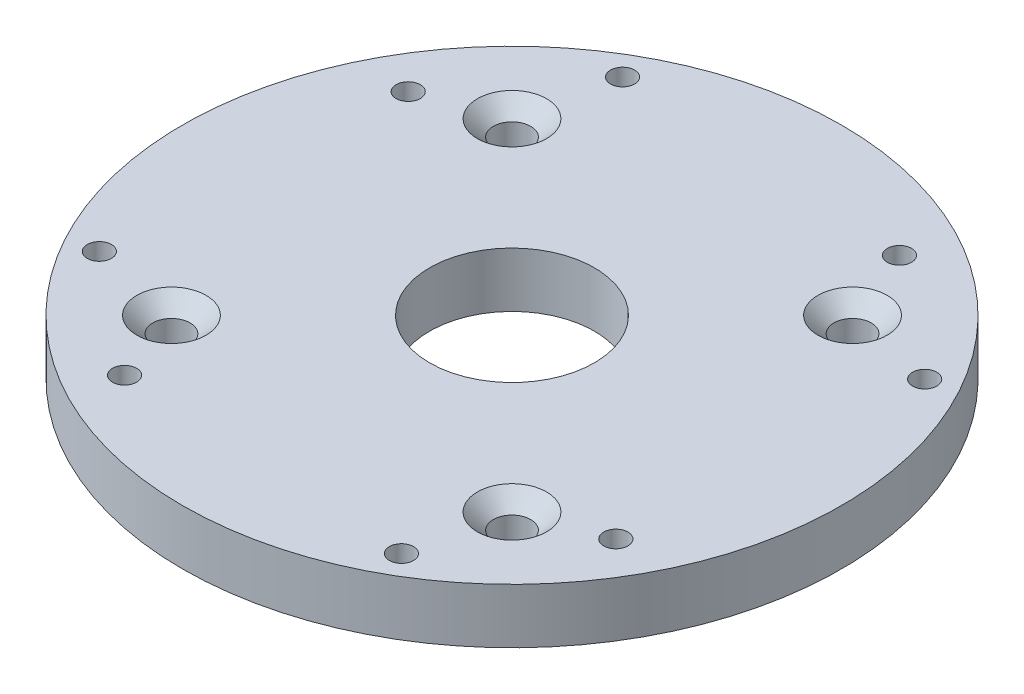
from build123d import *

# Parameters (mm, degrees)
SKETCH1_R                                       = 30
BOSS_EXTRUDE1_DEPTH                             = 5
CSK_FOR_M3_FLAT_HEAD_MACHINE_SCREW1_D           = 3.4
CSK_FOR_M3_FLAT_HEAD_MACHINE_SCREW1_CSINK_D     = 6.3
CSK_FOR_M3_FLAT_HEAD_MACHINE_SCREW1_CSINK_ANGLE = 90
CUT_EXTRUDE1_REACH                              = 44.72
SKETCH4_R                                       = 1.1
CUT_EXTRUDE2_REACH                              = 44.72
SKETCH5_R                                       = 7.5


with BuildPart() as part:
    # Sketch1 → Boss-Extrude1 (new body)
    with BuildSketch(Plane(origin=(0, 0, 0), x_dir=(1, 0, 0), z_dir=(0, 1, 0))):
        Circle(SKETCH1_R)
    extrude(amount=BOSS_EXTRUDE1_DEPTH)

    # CSK for M3 Flat Head Machine Screw1 (through all)
    with Locations(Plane(origin=(0, 5, 0), x_dir=(1, 0, 0), z_dir=(0, 1, 0))):
        with Locations((-15.5, -15.5), (15.5, 15.5), (-15.5, 15.5), (15.5, -15.5)):
            CounterSinkHole(CSK_FOR_M3_FLAT_HEAD_MACHINE_SCREW1_D / 2, CSK_FOR_M3_FLAT_HEAD_MACHINE_SCREW1_CSINK_D / 2, counter_sink_angle=CSK_FOR_M3_FLAT_HEAD_MACHINE_SCREW1_CSINK_ANGLE)

    # Sketch4 → Cut-Extrude1 (cut, up to next)
    with BuildSketch(Plane(origin=(0, 5, 0), x_dir=(1, 0, 0), z_dir=(0, 1, 0)), mode=Mode.PRIVATE) as cut_extrude1_sk1:
        with Locations((-13.75, 23.815698604)):
            Circle(SKETCH4_R)
    cut_extrude1_tool1 = extrude(cut_extrude1_sk1.sketch, amount=-CUT_EXTRUDE1_REACH, mode=Mode.PRIVATE) & part.part
    # Sketch4 → Cut-Extrude1 (cut, up to next)
    with BuildSketch(Plane(origin=(0, 5, 0), x_dir=(1, 0, 0), z_dir=(0, 1, 0)), mode=Mode.PRIVATE) as cut_extrude1_sk2:
        with Locations((-22.360001818, 12.909553069)):
            Circle(SKETCH4_R)
    cut_extrude1_tool2 = extrude(cut_extrude1_sk2.sketch, amount=-CUT_EXTRUDE1_REACH, mode=Mode.PRIVATE) & part.part
    # Sketch4 → Cut-Extrude1 (cut, up to next)
    with BuildSketch(Plane(origin=(0, 5, 0), x_dir=(1, 0, 0), z_dir=(0, 1, 0)), mode=Mode.PRIVATE) as cut_extrude1_sk3:
        with Locations((12.909553069, 22.360001818)):
            Circle(SKETCH4_R)
    cut_extrude1_tool3 = extrude(cut_extrude1_sk3.sketch, amount=-CUT_EXTRUDE1_REACH, mode=Mode.PRIVATE) & part.part
    # Sketch4 → Cut-Extrude1 (cut, up to next)
    with BuildSketch(Plane(origin=(0, 5, 0), x_dir=(1, 0, 0), z_dir=(0, 1, 0)), mode=Mode.PRIVATE) as cut_extrude1_sk4:
        with Locations((23.815698604, 13.75)):
            Circle(SKETCH4_R)
    cut_extrude1_tool4 = extrude(cut_extrude1_sk4.sketch, amount=-CUT_EXTRUDE1_REACH, mode=Mode.PRIVATE) & part.part
    # Sketch4 → Cut-Extrude1 (cut, up to next)
    with BuildSketch(Plane(origin=(0, 5, 0), x_dir=(1, 0, 0), z_dir=(0, 1, 0)), mode=Mode.PRIVATE) as cut_extrude1_sk5:
        with Locations((22.360001818, -12.909553069)):
            Circle(SKETCH4_R)
    cut_extrude1_tool5 = extrude(cut_extrude1_sk5.sketch, amount=-CUT_EXTRUDE1_REACH, mode=Mode.PRIVATE) & part.part
    # Sketch4 → Cut-Extrude1 (cut, up to next)
    with BuildSketch(Plane(origin=(0, 5, 0), x_dir=(1, 0, 0), z_dir=(0, 1, 0)), mode=Mode.PRIVATE) as cut_extrude1_sk6:
        with Locations((13.75, -23.815698604)):
            Circle(SKETCH4_R)
    cut_extrude1_tool6 = extrude(cut_extrude1_sk6.sketch, amount=-CUT_EXTRUDE1_REACH, mode=Mode.PRIVATE) & part.part
    # Sketch4 → Cut-Extrude1 (cut, up to next)
    with BuildSketch(Plane(origin=(0, 5, 0), x_dir=(1, 0, 0), z_dir=(0, 1, 0)), mode=Mode.PRIVATE) as cut_extrude1_sk7:
        with Locations((-12.909553069, -22.360001818)):
            Circle(SKETCH4_R)
    cut_extrude1_tool7 = extrude(cut_extrude1_sk7.sketch, amount=-CUT_EXTRUDE1_REACH, mode=Mode.PRIVATE) & part.part
    # Sketch4 → Cut-Extrude1 (cut, up to next)
    with BuildSketch(Plane(origin=(0, 5, 0), x_dir=(1, 0, 0), z_dir=(0, 1, 0)), mode=Mode.PRIVATE) as cut_extrude1_sk8:
        with Locations((-23.815698604, -13.75)):
            Circle(SKETCH4_R)
    cut_extrude1_tool8 = extrude(cut_extrude1_sk8.sketch, amount=-CUT_EXTRUDE1_REACH, mode=Mode.PRIVATE) & part.part
    add(cut_extrude1_tool1.solids().sort_by_distance((-13.75, 5, -23.815699))[0], mode=Mode.SUBTRACT)
    add(cut_extrude1_tool2.solids().sort_by_distance((-22.360002, 5, -12.909553))[0], mode=Mode.SUBTRACT)
    add(cut_extrude1_tool3.solids().sort_by_distance((12.909553, 5, -22.360002))[0], mode=Mode.SUBTRACT)
    add(cut_extrude1_tool4.solids().sort_by_distance((23.815699, 5, -13.75))[0], mode=Mode.SUBTRACT)
    add(cut_extrude1_tool5.solids().sort_by_distance((22.360002, 5, 12.909553))[0], mode=Mode.SUBTRACT)
    add(cut_extrude1_tool6.solids().sort_by_distance((13.75, 5, 23.815699))[0], mode=Mode.SUBTRACT)
    add(cut_extrude1_tool7.solids().sort_by_distance((-12.909553, 5, 22.360002))[0], mode=Mode.SUBTRACT)
    add(cut_extrude1_tool8.solids().sort_by_distance((-23.815699, 5, 13.75))[0], mode=Mode.SUBTRACT)

    # Sketch5 → Cut-Extrude2 (cut, up to next)
    with BuildSketch(Plane(origin=(0, 5, 0), x_dir=(1, 0, 0), z_dir=(0, 1, 0)), mode=Mode.PRIVATE) as cut_extrude2_sk1:
        Circle(SKETCH5_R)
    cut_extrude2_tool1 = extrude(cut_extrude2_sk1.sketch, amount=-CUT_EXTRUDE2_REACH, mode=Mode.PRIVATE) & part.part
    add(cut_extrude2_tool1.solids().sort_by_distance((0, 5, 0))[0], mode=Mode.SUBTRACT)


solid = part.part
